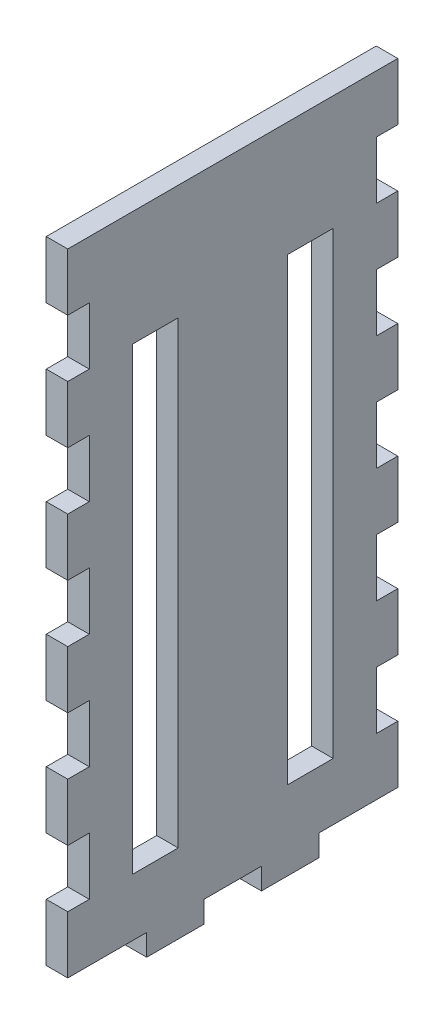
from build123d import *

# Parameters (mm, degrees)
SKETCH1_W               = 127
SKETCH1_H               = 279.4
BOSS_EXTRUDE1_DEPTH     = 9.525
SKETCH2_W               = 9.525
SKETCH2_H               = 25.4
BOSS_EXTRUDE2_DEPTH     = 9.525
LPATTERN1_COUNT         = 6
LPATTERN1_PITCH         = 50.8
MIRROR1_COPY_1_SKETCH_W = 9.525
MIRROR1_COPY_1_SKETCH_H = 25.4
MIRROR1_COPY_1_DEPTH    = 9.525
MIRROR1_COPY_2_SKETCH_W = 9.525
MIRROR1_COPY_2_SKETCH_H = 25.4
MIRROR1_COPY_2_DEPTH    = 9.525
MIRROR1_COPY_3_SKETCH_W = 9.525
MIRROR1_COPY_3_SKETCH_H = 25.4
MIRROR1_COPY_3_DEPTH    = 9.525
MIRROR1_COPY_4_SKETCH_W = 9.525
MIRROR1_COPY_4_SKETCH_H = 25.4
MIRROR1_COPY_4_DEPTH    = 9.525
MIRROR1_COPY_5_SKETCH_W = 9.525
MIRROR1_COPY_5_SKETCH_H = 25.4
MIRROR1_COPY_5_DEPTH    = 9.525
MIRROR1_COPY_6_SKETCH_W = 9.525
MIRROR1_COPY_6_SKETCH_H = 25.4
MIRROR1_COPY_6_DEPTH    = 9.525
SKETCH3_W               = 9.525
SKETCH3_H               = 25.4
BOSS_EXTRUDE3_DEPTH     = 9.525
LPATTERN2_COUNT         = 2
LPATTERN2_PITCH         = 50.8
SKETCH4_W               = 20.32
SKETCH4_H               = 203.2
CUT_EXTRUDE1_DEPTH      = 9.525


with BuildPart() as part:
    # Sketch1 → Boss-Extrude1 (new body)
    with BuildSketch(Plane(origin=(0, 0, 0), x_dir=(0, 0, -1), z_dir=(1, 0, 0))):
        Rectangle(SKETCH1_W, SKETCH1_H)
    extrude(amount=BOSS_EXTRUDE1_DEPTH)

    # Sketch2 → Boss-Extrude2 (add)
    with BuildSketch(Plane.XY.offset(63.5)):
        with Locations((4.7625, 127)):
            Rectangle(SKETCH2_W, SKETCH2_H)
    boss_extrude2 = extrude(amount=BOSS_EXTRUDE2_DEPTH)

    # LPattern1: Boss-Extrude2 ×6
    with Locations(*[(0, -i * LPATTERN1_PITCH, 0) for i in range(1, LPATTERN1_COUNT)]):
        add(boss_extrude2)

    # Mirror1 copy 1 sketch → Mirror1 copy 1 (add)
    with BuildSketch(Plane(origin=(0, -50.8, -63.5), x_dir=(1, 0, 0), z_dir=(0, 0, -1))):
        with Locations((4.7625, -127)):
            Rectangle(MIRROR1_COPY_1_SKETCH_W, MIRROR1_COPY_1_SKETCH_H)
    extrude(amount=MIRROR1_COPY_1_DEPTH)

    # Mirror1 copy 2 sketch → Mirror1 copy 2 (add)
    with BuildSketch(Plane(origin=(0, -101.6, -63.5), x_dir=(1, 0, 0), z_dir=(0, 0, -1))):
        with Locations((4.7625, -127)):
            Rectangle(MIRROR1_COPY_2_SKETCH_W, MIRROR1_COPY_2_SKETCH_H)
    extrude(amount=MIRROR1_COPY_2_DEPTH)

    # Mirror1 copy 3 sketch → Mirror1 copy 3 (add)
    with BuildSketch(Plane(origin=(0, -152.4, -63.5), x_dir=(1, 0, 0), z_dir=(0, 0, -1))):
        with Locations((4.7625, -127)):
            Rectangle(MIRROR1_COPY_3_SKETCH_W, MIRROR1_COPY_3_SKETCH_H)
    extrude(amount=MIRROR1_COPY_3_DEPTH)

    # Mirror1 copy 4 sketch → Mirror1 copy 4 (add)
    with BuildSketch(Plane(origin=(0, -203.2, -63.5), x_dir=(1, 0, 0), z_dir=(0, 0, -1))):
        with Locations((4.7625, -127)):
            Rectangle(MIRROR1_COPY_4_SKETCH_W, MIRROR1_COPY_4_SKETCH_H)
    extrude(amount=MIRROR1_COPY_4_DEPTH)

    # Mirror1 copy 5 sketch → Mirror1 copy 5 (add)
    with BuildSketch(Plane(origin=(0, -254, -63.5), x_dir=(1, 0, 0), z_dir=(0, 0, -1))):
        with Locations((4.7625, -127)):
            Rectangle(MIRROR1_COPY_5_SKETCH_W, MIRROR1_COPY_5_SKETCH_H)
    extrude(amount=MIRROR1_COPY_5_DEPTH)

    # Mirror1 copy 6 sketch → Mirror1 copy 6 (add)
    with BuildSketch(Plane(origin=(0, 0, -63.5), x_dir=(1, 0, 0), z_dir=(0, 0, -1))):
        with Locations((4.7625, -127)):
            Rectangle(MIRROR1_COPY_6_SKETCH_W, MIRROR1_COPY_6_SKETCH_H)
    extrude(amount=MIRROR1_COPY_6_DEPTH)

    # Sketch3 → Boss-Extrude3 (add)
    with BuildSketch(Plane.XZ.offset(139.7)):
        with Locations((4.7625, 25.4)):
            Rectangle(SKETCH3_W, SKETCH3_H)
    boss_extrude3 = extrude(amount=BOSS_EXTRUDE3_DEPTH)

    # LPattern2: Boss-Extrude3 ×2
    with Locations(*[(0, 0, -i * LPATTERN2_PITCH) for i in range(1, LPATTERN2_COUNT)]):
        add(boss_extrude3)

    # Sketch4 → Cut-Extrude1 (cut)
    with BuildSketch(Plane(origin=(9.525, 0, 0), x_dir=(0, 0, -1), z_dir=(1, 0, 0))):
        with Locations((-34.29, -12.7)):
            Rectangle(SKETCH4_W, SKETCH4_H)
    cut_extrude1 = extrude(amount=-CUT_EXTRUDE1_DEPTH, mode=Mode.SUBTRACT)

    # Mirror2: Cut-Extrude1 across plane
    add(cut_extrude1.mirror(Plane.XY), mode=Mode.SUBTRACT)


solid = part.part
